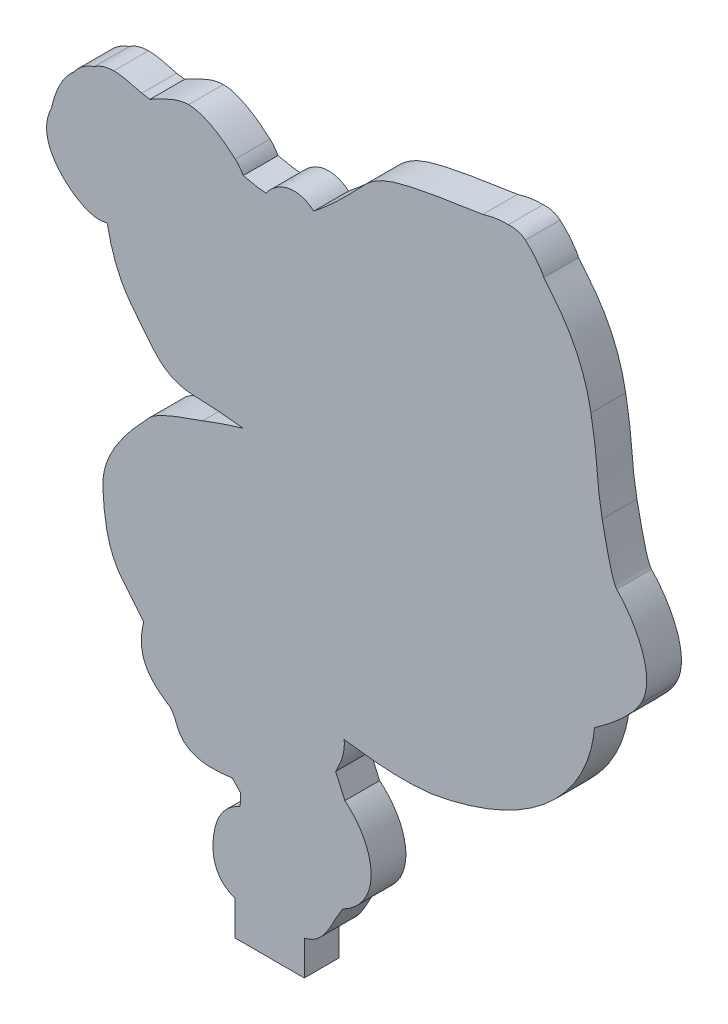
from build123d import *

# Parameters (mm, degrees)
BASE_FLANGE1_DEPTH = 2.3
SKETCH9_W          = 4.6
SKETCH9_H          = 2.3
TAB2_DEPTH         = 2.3


# Sheet-metal steps are written as plain solids
with BuildPart() as part:
    # Model → Base-Flange1 (new body)
    with BuildSketch(Plane.XY):
        with BuildLine():
            Line((258.872397146, -363.795578641), (258.340446595, -363.712963676))
            add(Edge.make_bspline(
                [(258.340446595, -363.712963676), (257.102172757, -363.356215382), (256.632698326, -363.356215382), (256.475502968, -363.356215382)],
                knots=[8, 8, 8, 8, 9, 9, 9, 9], degree=3))
            add(Edge.make_bspline(
                [(256.475502968, -363.356215382), (256.009003058, -363.35446041), (255.553436381, -363.502578837), (255.181961013, -363.763135862)],
                knots=[9, 9, 9, 9, 10, 10, 10, 10], degree=3))
            add(Edge.make_bspline(
                [(255.181961013, -363.763135862), (254.61935208, -363.947490852), (254.137386149, -364.308582381), (253.796684542, -364.788996088)],
                knots=[10, 10, 10, 10, 11, 11, 11, 11], degree=3))
            add(Edge.make_bspline(
                [(253.796684542, -364.788996088), (253.112631486, -365.335540723), (252.561980801, -366.509985051), (252.363347956, -367.554213129)],
                knots=[11, 11, 11, 11, 12, 12, 12, 12], degree=3))
            add(Edge.make_bspline(
                [(252.363347956, -367.554213129), (251.292298247, -369.601129513), (253.084159031, -371.313241657), (254.113075303, -371.91607939)],
                knots=[12, 12, 12, 12, 13, 13, 13, 13], degree=3))
            add(Edge.make_bspline(
                [(254.113075303, -371.91607939), (254.794385244, -372.323972969), (255.361618749, -372.472065776), (256.043631973, -372.294282429)],
                knots=[13, 13, 13, 13, 14, 14, 14, 14], degree=3))
            add(Edge.make_bspline(
                [(256.043631973, -372.294282429), (256.310734133, -373.710026601), (256.813020202, -375.173008438), (257.730121712, -376.292814147)],
                knots=[14, 14, 14, 14, 15, 15, 15, 15], degree=3))
            add(Edge.make_bspline(
                [(257.730121712, -376.292814147), (258.497979568, -377.192653975), (259.081240118, -378.196938842), (259.942517788, -378.7705408)],
                knots=[15, 15, 15, 15, 16, 16, 16, 16], degree=3))
            add(Edge.make_bspline(
                [(259.942517788, -378.7705408), (260.701869281, -379.27216983), (261.5153583, -379.339786124), (262.210960953, -379.339786124)],
                knots=[16, 16, 16, 16, 17, 17, 17, 17], degree=3))
            add(Edge.make_bspline(
                [(262.210960953, -379.339786124), (262.817976246, -379.339786124), (263.929003467, -379.435932499), (265.041776853, -379.568067535)],
                knots=[17, 17, 17, 17, 18, 18, 18, 18], degree=3))
            add(Edge.make_bspline(
                [(265.041776853, -379.568067535), (263.479630225, -380.029561986), (262.850723669, -380.306968395), (262.360517171, -380.482783945)],
                knots=[18, 18, 18, 18, 19, 19, 19, 19], degree=3))
            add(Edge.make_bspline(
                [(262.360517171, -380.482783945), (260.282574516, -381.193217879), (259.133330439, -381.652890954), (258.722514931, -382.190846024)],
                knots=[19, 19, 19, 19, 20, 20, 20, 20], degree=3))
            add(Edge.make_bspline(
                [(258.722514931, -382.190846024), (257.20038636, -383.790652427), (255.644784401, -385.661685175), (255.760676668, -387.675462928)],
                knots=[20, 20, 20, 20, 21, 21, 21, 21], degree=3))
            add(Edge.make_bspline(
                [(255.760676668, -387.675462928), (255.867797332, -389.612775698), (256.133904584, -391.135833734), (257.084365946, -392.271575533)],
                knots=[21, 21, 21, 21, 22, 22, 22, 22], degree=3))
            add(Edge.make_bspline(
                [(257.084365946, -392.271575533), (257.285702702, -392.51196185), (257.755583218, -393.090348122), (258.457865963, -393.961982878)],
                knots=[22, 22, 22, 22, 23, 23, 23, 23], degree=3))
            add(Edge.make_bspline(
                [(258.457865963, -393.961982878), (257.930741372, -396.086078132), (258.835917618, -397.102047436), (260.265632875, -397.998581877)],
                knots=[23, 23, 23, 23, 24, 24, 24, 24], degree=3))
            add(Edge.make_bspline(
                [(260.265632875, -397.998581877), (260.369387496, -398.137238074), (260.55017637, -398.490440486), (260.642946402, -398.740282488)],
                knots=[24, 24, 24, 24, 25, 25, 25, 25], degree=3))
            add(Edge.make_bspline(
                [(260.642946402, -398.740282488), (261.209875025, -400.259574159), (262.875440397, -400.164932984), (264.322499466, -399.979425454)],
                knots=[25, 25, 25, 25, 26, 26, 26, 26], degree=3))
            Line((264.322499466, -399.979425454), (264.887586522, -400.562131996))
            add(Edge.make_bspline(
                [(264.887586522, -400.562131996), (264.876114631, -400.864224805), (264.860967675, -401.133752563), (264.845150679, -401.351600116)],
                knots=[27, 27, 27, 27, 28, 28, 28, 28], degree=3))
            add(Edge.make_bspline(
                [(264.845150679, -401.351600116), (263.430338911, -401.96024249), (263.109530454, -403.263240278), (263.049723659, -404.357047591)],
                knots=[28, 28, 28, 28, 29, 29, 29, 29], degree=3))
            add(Edge.make_bspline(
                [(263.049723659, -404.357047591), (263.001341567, -405.241908361), (263.287078244, -406.147201915), (264.116888391, -406.604878935)],
                knots=[29, 29, 29, 29, 30, 30, 30, 30], degree=3))
            add(Edge.make_bspline(
                [(264.116888391, -406.604878935), (264.203538156, -406.661659444), (264.310476644, -406.712599047), (264.434195613, -406.757853518)],
                knots=[30, 30, 30, 30, 31, 31, 31, 31], degree=3))
            Line((264.434195613, -406.757853518), (269.137586815, -406.757772651))
            add(Edge.make_bspline(
                [(269.137586815, -406.757772651), (269.556913154, -406.643398105), (269.785512137, -406.504655605), (270.011173306, -406.318505513)],
                knots=[32, 32, 32, 32, 33, 33, 33, 33], degree=3))
            add(Edge.make_bspline(
                [(270.011173306, -406.318505513), (270.694394242, -405.754909925), (271.096364494, -404.643678371), (271.619799516, -403.843009885)],
                knots=[33, 33, 33, 33, 34, 34, 34, 34], degree=3))
            add(Edge.make_bspline(
                [(271.619799516, -403.843009885), (274.380082617, -402.39542121), (273.859011699, -399.252989356), (271.778172518, -397.549885205)],
                knots=[34, 34, 34, 34, 35, 35, 35, 35], degree=3))
            Line((271.778172518, -397.549885205), (271.168172503, -396.180971124))
            add(Edge.make_bspline(
                [(271.168172503, -396.180971124), (271.55056252, -395.46553604), (271.790347913, -394.805938132), (271.732508302, -394.069948859)],
                knots=[36, 36, 36, 36, 37, 37, 37, 37], degree=3))
            add(Edge.make_bspline(
                [(271.732508302, -394.069948859), (273.88580142, -394.364785311), (275.621007018, -394.52101491), (277.517405963, -394.295481162)],
                knots=[37, 37, 37, 37, 38, 38, 38, 38], degree=3))
            add(Edge.make_bspline(
                [(277.517405963, -394.295481162), (284.51411226, -393.074010998), (287.940203407, -389.217208572), (288.3042126, -385.101436138)],
                knots=[38, 38, 38, 38, 39, 39, 39, 39], degree=3))
            add(Edge.make_bspline(
                [(288.3042126, -385.101436138), (289.412965748, -384.337033733), (290.82871887, -383.182054508), (291.406089985, -382.122773329)],
                knots=[39, 39, 39, 39, 40, 40, 40, 40], degree=3))
            add(Edge.make_bspline(
                [(291.406089985, -382.122773329), (292.446214832, -380.214110858), (290.955843661, -377.623538676), (289.772106988, -376.438928923)],
                knots=[40, 40, 40, 40, 41, 41, 41, 41], degree=3))
            add(Edge.make_bspline(
                [(289.772106988, -376.438928923), (289.360991342, -375.871352456), (289.054644482, -373.883183799), (288.814254345, -372.892357973)],
                knots=[41, 41, 41, 41, 42, 42, 42, 42], degree=3))
            add(Edge.make_bspline(
                [(288.814254345, -372.892357973), (288.385386538, -370.678365432), (288.588190274, -369.981235925), (288.067737839, -367.171102485)],
                knots=[42, 42, 42, 42, 43, 43, 43, 43], degree=3))
            add(Edge.make_bspline(
                [(288.067737839, -367.171102485), (287.429932713, -363.50021078), (285.413229012, -361.625957626), (284.941866287, -360.97594047)],
                knots=[43, 43, 43, 43, 44, 44, 44, 44], degree=3))
            add(Edge.make_bspline(
                [(284.941866287, -360.97594047), (284.819260833, -360.628471203), (284.276915253, -359.912923043), (283.73194671, -359.442080556)],
                knots=[44, 44, 44, 44, 45, 45, 45, 45], degree=3))
            add(Edge.make_bspline(
                [(283.73194671, -359.442080556), (283.311019249, -359.081440044), (282.605772307, -359.113922017)],
                knots=[45, 45, 45, 46, 46, 46], degree=2))
            add(Edge.make_bspline(
                [(282.605772307, -359.113922017), (282.107222216, -359.113922017), (281.662947649, -359.143891723), (280.902777541, -359.375820909)],
                knots=[0, 0, 0, 0, 1, 1, 1, 1], degree=3))
            add(Edge.make_bspline(
                [(280.902777541, -359.375820909), (271.588289586, -360.747860342), (274.754006955, -360.734792281), (269.723440936, -364.779208584)],
                knots=[1, 1, 1, 1, 2, 2, 2, 2], degree=3))
            add(Edge.make_bspline(
                [(269.723440936, -364.779208584), (268.729495671, -363.9377214), (267.410421226, -364.174392622), (266.557304967, -365.323649821)],
                knots=[2, 2, 2, 2, 3, 3, 3, 3], degree=3))
            add(Edge.make_bspline(
                [(266.557304967, -365.323649821), (266.001832387, -365.28688041), (266.252058122, -365.327222346), (265.051482275, -365.078128088)],
                knots=[3, 3, 3, 3, 4, 4, 4, 4], degree=3))
            add(Edge.make_bspline(
                [(265.051482275, -365.078128088), (264.923261056, -364.826533524), (264.747284285, -364.595969706), (264.52627273, -364.398663812)],
                knots=[4, 4, 4, 4, 5, 5, 5, 5], degree=3))
            add(Edge.make_bspline(
                [(264.52627273, -364.398663812), (264.1268682, -364.035394357), (262.68900377, -362.816385477), (261.436192103, -362.816140934)],
                knots=[5, 5, 5, 5, 6, 6, 6, 6], degree=3))
            add(Edge.make_bspline(
                [(261.436192103, -362.816140934), (260.662749573, -362.831743514), (259.83594122, -363.270833806), (258.872397146, -363.795578641)],
                knots=[6, 6, 6, 6, 7, 7, 7, 7], degree=3))
        make_face()
    extrude(amount=-BASE_FLANGE1_DEPTH)

    # Sketch9 → Tab2 (add)
    with BuildSketch(Plane.XY):
        with Locations((266.794458406, -407.907773393)):
            Rectangle(SKETCH9_W, SKETCH9_H)
    extrude(amount=-TAB2_DEPTH)


solid = part.part
